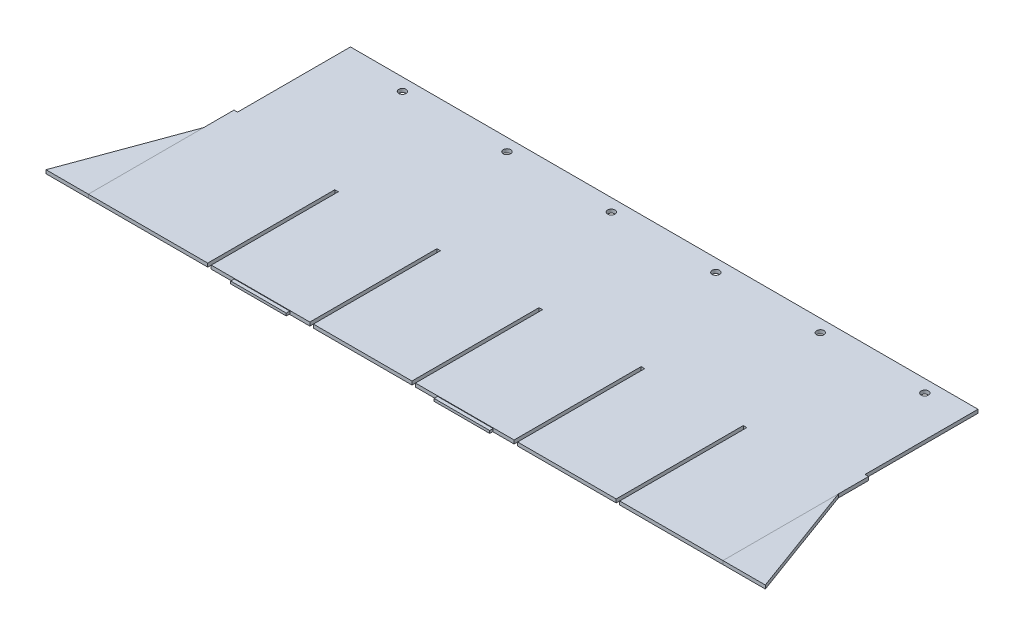
from build123d import *

# Parameters (mm, degrees)
SKETCH1_W             = 570.861
SKETCH1_H             = 3.175
BOSS_EXTRUDE1_DEPTH   = 232.6
SKETCH2_W             = 3.175
SKETCH2_H             = 114.3
CUT_EXTRUDE1_DEPTH    = 3.175
SKETCH7_R             = 3.302
CUT_EXTRUDE4_DEPTH    = 369.216527271
SKETCH6_W             = 50
SKETCH6_H             = 2.286
BOSS_EXTRUDE2_DEPTH   = 3.175
LPATTERN1_COUNT       = 6
LPATTERN1_PITCH       = 93.98
BOSS_EXTRUDE4_DEPTH   = 3.175
BOSS_EXTRUDE4_2_DEPTH = 3.175
LPATTERN2_COUNT       = 5
LPATTERN2_PITCH       = 91.86599991
SKETCH2_4_W           = 3.175
SKETCH2_4_H           = 101.6
CUT_EXTRUDE5_DEPTH    = 401.339750312


with BuildPart() as part:
    # Sketch1 → Boss-Extrude1 (new body)
    with BuildSketch(Plane.XY):
        Rectangle(SKETCH1_W, SKETCH1_H)
    extrude(amount=BOSS_EXTRUDE1_DEPTH)

    # Sketch2 → Cut-Extrude1 (cut)
    with BuildSketch(Plane(origin=(0, 1.5875, 0), x_dir=(1, 0, 0), z_dir=(0, 1, 0))):
        with Locations((-176.4739996, -175.45)):
            Rectangle(SKETCH2_W, SKETCH2_H)
    cut_extrude1 = extrude(amount=-CUT_EXTRUDE1_DEPTH, mode=Mode.SUBTRACT)

    # Sketch7 → Cut-Extrude4 (cut, through all)
    with BuildSketch(Plane(origin=(0, -1.5875, 0), x_dir=(-1, 0, 0), z_dir=(0, -1, 0))):
        with Locations((-245.6805, -11.29165)):
            Circle(SKETCH7_R)
    cut_extrude4 = extrude(amount=-CUT_EXTRUDE4_DEPTH, mode=Mode.SUBTRACT)

    # Sketch6 → Boss-Extrude2 (add)
    with BuildSketch(Plane.XY.offset(232.6)):
        with Locations((53.761993, 0)):
            Rectangle(SKETCH6_W, SKETCH6_H)
        with Locations((-129.238007, 0)):
            Rectangle(SKETCH6_W, SKETCH6_H)
    extrude(amount=BOSS_EXTRUDE2_DEPTH)

    # LPattern1: Cut-Extrude4 ×6
    with Locations(*[(-i * LPATTERN1_PITCH, 0, 0) for i in range(1, LPATTERN1_COUNT)]):
        add(cut_extrude4, mode=Mode.SUBTRACT)

    # LPattern2: Cut-Extrude1 ×5
    with Locations(*[(i * LPATTERN2_PITCH, 0, 0) for i in range(1, LPATTERN2_COUNT)]):
        add(cut_extrude1, mode=Mode.SUBTRACT)

    # Sketch2<4> → Cut-Extrude5 (cut, through all)
    with BuildSketch(Plane(origin=(0, 1.5875, 0), x_dir=(1, 0, 0), z_dir=(0, 1, 0))):
        with Locations((283.843, -50.8)):
            Rectangle(SKETCH2_4_W, SKETCH2_4_H)
        with Locations((-283.843, -50.8)):
            Rectangle(SKETCH2_4_W, SKETCH2_4_H)
    extrude(amount=-CUT_EXTRUDE5_DEPTH, mode=Mode.SUBTRACT)


with BuildPart() as body_2:
    # Sketch2<3> → Boss-Extrude4 (new body)
    with BuildSketch(Plane(origin=(0, 1.5875, 0), x_dir=(1, 0, 0), z_dir=(0, 1, 0))):
        Polygon((-323.5305, -232.6), (-285.4305, -232.6), (-285.4305, -128.857841698), align=None)
    extrude(amount=-BOSS_EXTRUDE4_DEPTH)


with BuildPart() as body_3:
    # Sketch2<3> → Boss-Extrude4 2 (new body)
    with BuildSketch(Plane(origin=(0, 1.5875, 0), x_dir=(1, 0, 0), z_dir=(0, 1, 0))):
        Polygon((285.4305, -128.857841698), (285.4305, -232.6), (323.5305, -232.6), align=None)
    extrude(amount=-BOSS_EXTRUDE4_2_DEPTH)


solid = Compound([part.part, body_2.part, body_3.part])
